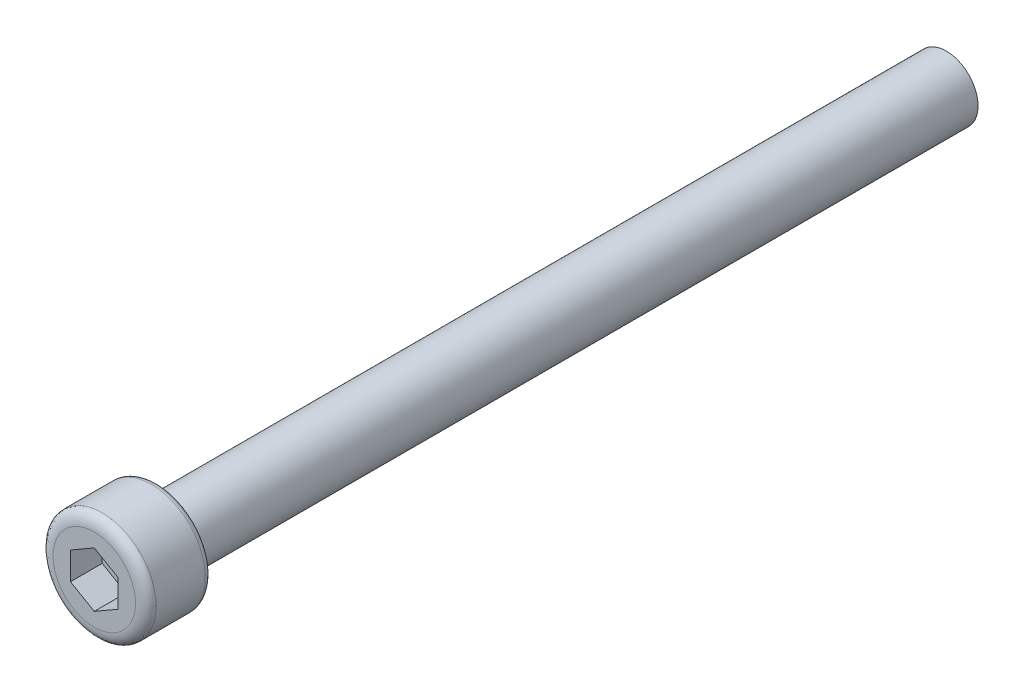
from build123d import *

# Parameters (mm, degrees)
CHAMFER_1_SIZE      = 0.3
CHAMFER_1_SIZE2     = 0.519615242
FILLET_1_R          = 0.4
FILLET_2_SIZE       = 0.5
FILLET_2_SIZE_2     = 0.8
CUT_EXTRUDE_1_DEPTH = 2


with BuildPart() as part:
    # 草图2 → 旋转1 (revolve)
    with BuildSketch(Plane(origin=(0, 0, 0), x_dir=(0, 0, -1), z_dir=(1, 0, 0)), mode=Mode.PRIVATE) as revolve_1_sk:
        Polygon((-27, 0), (-27, 3.4), (-23, 3.4), (-23, 2), (27, 2), (27, 0), align=None)
    revolve(revolve_1_sk.sketch.rotate(Axis((0, 0, -27), (0, 0, 1)), 90), axis=Axis((0, 0, -27), (0, 0, 1)))

    # 倒角1
    chamfer_1_edges = [part.edges().sort_by_distance(p)[0] for p in [
        (2, 0, -27),
    ]]
    chamfer_1_side = [part.faces().sort_by_distance(p)[0] for p in [
        (2, 0, -2),
    ]]
    chamfer(chamfer_1_edges, length=CHAMFER_1_SIZE, length2=CHAMFER_1_SIZE2, reference=chamfer_1_side[0])

    # 圆角1
    fillet_1_edges = [part.edges().sort_by_distance(p)[0] for p in [
        (3.4, 0, 23),
    ]]
    fillet(fillet_1_edges, radius=FILLET_1_R)

    # 圆角2
    # an asymmetric fillet: 0.8, 0.5 mm, written as the material it takes off along each edge
    with BuildSketch(Plane(origin=(0, 0, 27), x_dir=(-1, 0, 0), z_dir=(0, 1, 0))) as fillet_2_piece_1:
        with BuildLine():
            Bezier((3.4, -FILLET_2_SIZE), (3.4, 0), (3.4 - FILLET_2_SIZE_2, 0), weights=[1, 0.707106781, 1])
            Line((3.4 - FILLET_2_SIZE_2, 0), (3.4, 0))
            Line((3.4, 0), (3.4, -FILLET_2_SIZE))
        make_face()
    revolve(axis=Axis((0, 0, 27), (0, 0, 1)), mode=Mode.SUBTRACT)

    # 草图3 → 切除-拉伸1 (cut)
    with BuildSketch(Plane.XY.offset(27)):
        Polygon((0, 1.732050808), (-1.5, 0.866025404), (-1.5, -0.866025404), (0, -1.732050808), (1.5, -0.866025404), (1.5, 0.866025404), align=None)
    extrude(amount=-CUT_EXTRUDE_1_DEPTH, mode=Mode.SUBTRACT)


solid = part.part
